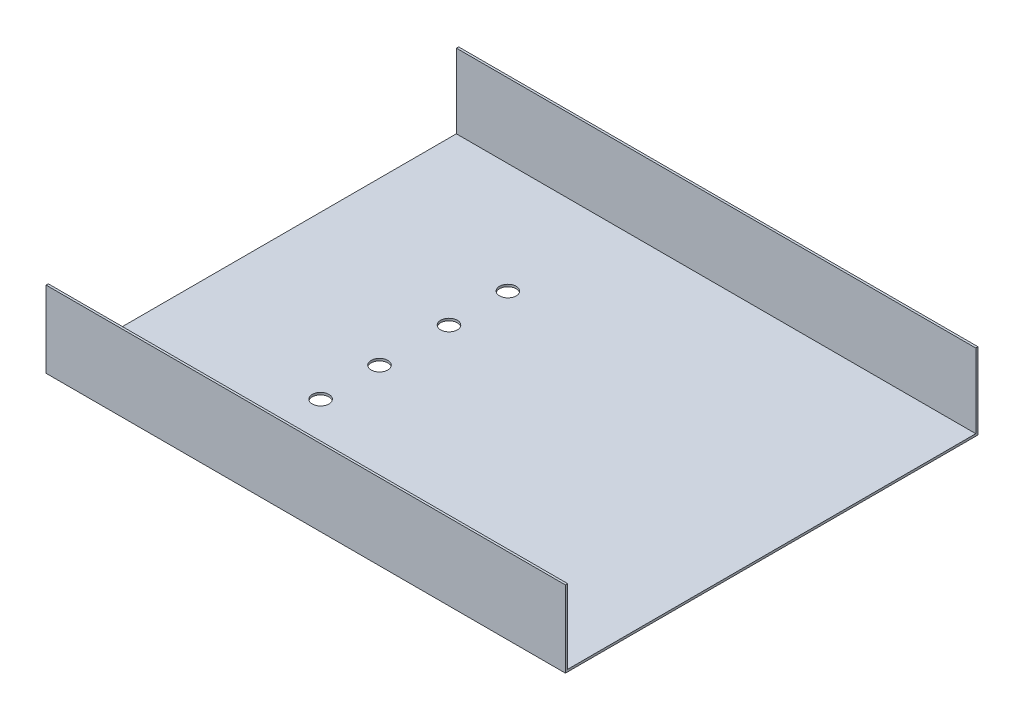
from build123d import *

# Parameters (mm, degrees)
CROQUIS1_W                   = 110
CROQUIS1_H                   = 20
SALIENTE_EXTRUIR1_DEPTH      = 140
VACIADO1_T                   = 0.6
TALADRO_DE_MARGEN_PARA_M42_D = 4.5


with BuildPart() as part:
    # Croquis1 → Saliente-Extruir1 (new body)
    with BuildSketch(Plane(origin=(0, 0, 0), x_dir=(0, 0, -1), z_dir=(1, 0, 0))):
        with Locations((55, 10)):
            Rectangle(CROQUIS1_W, CROQUIS1_H)
    extrude(amount=SALIENTE_EXTRUIR1_DEPTH)

    # Vaciado1
    vaciado1_openings = [part.faces().sort_by_distance(p)[0] for p in [
        (0, 10, -55),
        (140, 10, -55),
        (70, 20, -55),
    ]]
    offset(amount=VACIADO1_T, openings=vaciado1_openings, kind=Kind.INTERSECTION)

    # Taladro de margen para M42 (through all)
    with Locations(Plane(origin=(104.234059149, 1, -171.2), x_dir=(1, 0, 0), z_dir=(0, 1, 0))):
        with Locations((-60.584059149, -90.9625), (-60.584059149, -106.8375), (-60.584059149, -125.5625), (-60.584059149, -141.4375)):
            Hole(TALADRO_DE_MARGEN_PARA_M42_D / 2)


solid = part.part
